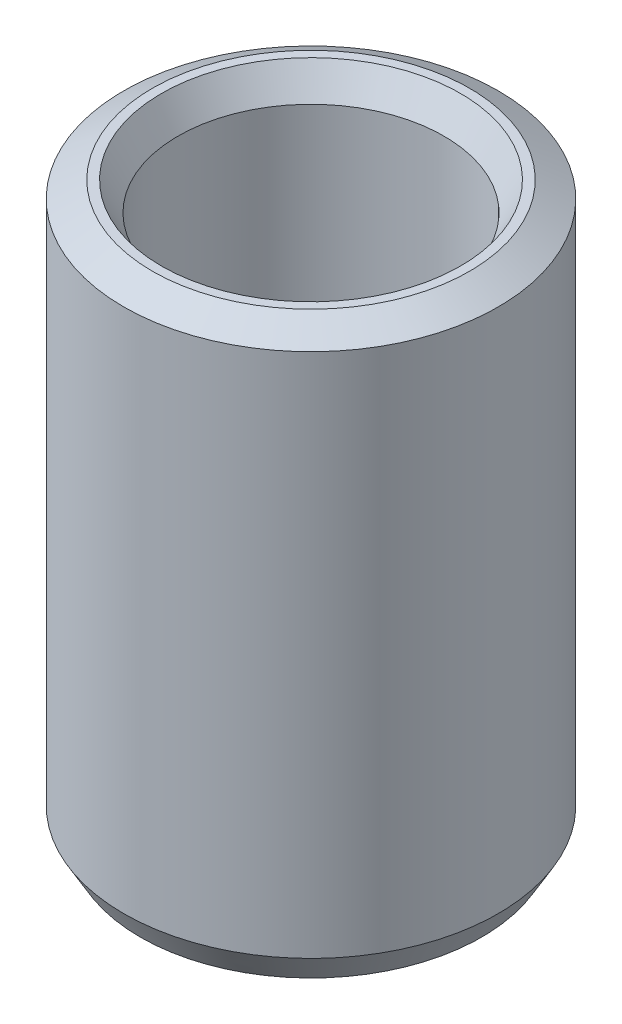
from build123d import *
from OCP.BRepFilletAPI import BRepFilletAPI_MakeChamfer

# Parameters (mm, degrees)
SKETCH1_R           = 25
BOSS_EXTRUDE1_DEPTH = 76.193831344
SKETCH2_R           = 17.756867447
CUT_EXTRUDE1_DEPTH  = 84.99702337
CHAMFER1_SIZE       = 2.209700478
CHAMFER1_SIZE2      = 3.827313497


with BuildPart() as part:
    # Sketch1 → Boss-Extrude1 (new body)
    with BuildSketch(Plane(origin=(0, 0, 0), x_dir=(1, 0, 0), z_dir=(0, 1, 0))):
        Circle(SKETCH1_R)
    extrude(amount=BOSS_EXTRUDE1_DEPTH)

    # Sketch2 → Cut-Extrude1 (cut, through all)
    with BuildSketch(Plane(origin=(0, 0, 0), x_dir=(1, 0, 0), z_dir=(0, 1, 0))):
        Circle(SKETCH2_R)
    extrude(amount=CUT_EXTRUDE1_DEPTH, mode=Mode.SUBTRACT)

    # Chamfer1: one chamfer whose edges measure the first distance from different faces: ONE call of the kernel's chamfer builder (chamfer() names one face for all edges)
    chamfer1_edges_1 = [part.edges().sort_by_distance(p)[0] for p in [
        (-17.756867447, 76.193831344, 0),
    ]]
    chamfer1_side_1 = [part.faces().sort_by_distance(p)[0] for p in [
        (-24.292893219, 76.193831344, 0),
    ]]
    chamfer1_edges_2 = [part.edges().sort_by_distance(p)[0] for p in [
        (-17.756867447, 0, 0),
    ]]
    chamfer1_side_2 = [part.faces().sort_by_distance(p)[0] for p in [
        (-17.756867447, 38.096915672, 0),
    ]]
    chamfer1_edges_3 = [part.edges().sort_by_distance(p)[0] for p in [
        (-25, 0, 0),
    ]]
    chamfer1_side_3 = [part.faces().sort_by_distance(p)[0] for p in [
        (-24.292893219, 0, 0),
    ]]
    chamfer1_edges_4 = [part.edges().sort_by_distance(p)[0] for p in [
        (-25, 76.193831344, 0),
    ]]
    chamfer1_side_4 = [part.faces().sort_by_distance(p)[0] for p in [
        (-25, 38.096915672, 0),
    ]]
    chamfer1 = BRepFilletAPI_MakeChamfer(part.part.solid().wrapped)
    for e in chamfer1_edges_1:
        chamfer1.Add(CHAMFER1_SIZE, CHAMFER1_SIZE2, e.wrapped, chamfer1_side_1[0].wrapped)  # the first distance lies on this face
    for e in chamfer1_edges_2:
        chamfer1.Add(CHAMFER1_SIZE, CHAMFER1_SIZE2, e.wrapped, chamfer1_side_2[0].wrapped)  # the first distance lies on this face
    for e in chamfer1_edges_3:
        chamfer1.Add(CHAMFER1_SIZE, CHAMFER1_SIZE2, e.wrapped, chamfer1_side_3[0].wrapped)  # the first distance lies on this face
    for e in chamfer1_edges_4:
        chamfer1.Add(CHAMFER1_SIZE, CHAMFER1_SIZE2, e.wrapped, chamfer1_side_4[0].wrapped)  # the first distance lies on this face
    add(Compound.cast(chamfer1.Shape()), mode=Mode.REPLACE)


solid = part.part
